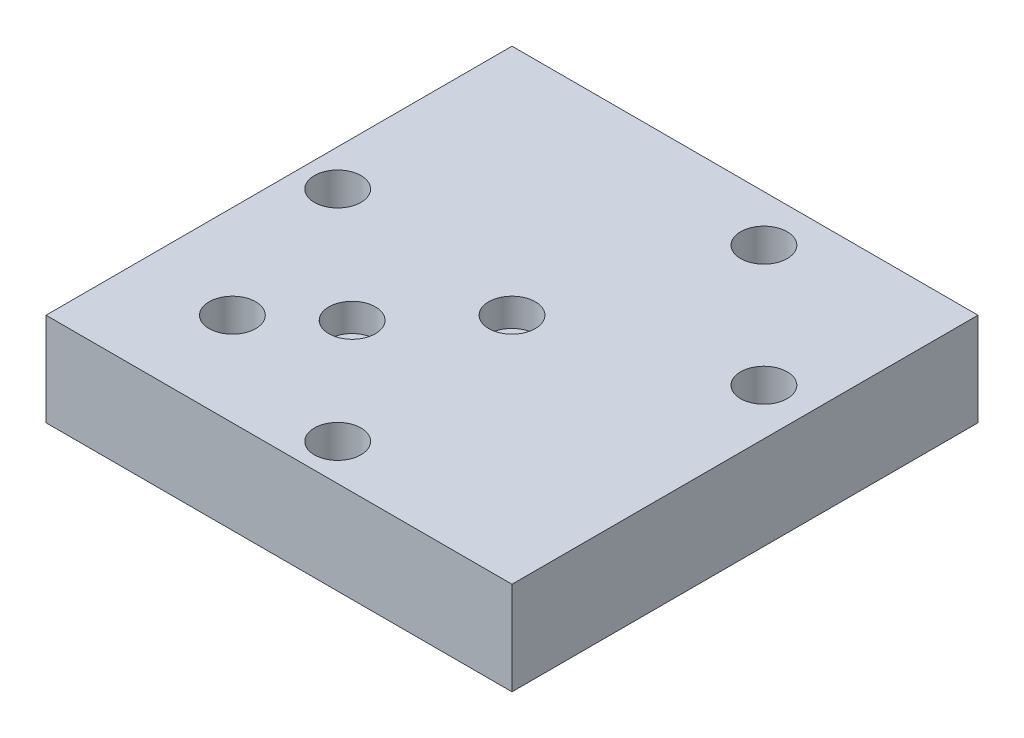
from build123d import *

# Parameters (mm, degrees)
SKETCH1_W                                           = 1270
SKETCH1_H                                           = 1270
SKETCH1_R                                           = 63.5
BOSS_EXTRUDE1_DEPTH                                 = 254
CBORE_FOR_00_BINDING_HEAD_MACHINE_SCREW_D           = 76.2
CBORE_FOR_00_BINDING_HEAD_MACHINE_SCREW_CBORE_D     = 127
CBORE_FOR_00_BINDING_HEAD_MACHINE_SCREW_CBORE_DEPTH = 76.2


with BuildPart() as part:
    # Sketch1 → Boss-Extrude1 (new body)
    with BuildSketch(Plane(origin=(0, 0, 0), x_dir=(1, 0, 0), z_dir=(0, 1, 0))):
        Rectangle(SKETCH1_W, SKETCH1_H)
        with Locations((-381, -381)):
            Circle(SKETCH1_R, mode=Mode.SUBTRACT)
        with Locations((-535.427409328, 60.328180312)):
            Circle(SKETCH1_R, mode=Mode.SUBTRACT)
        with Locations((177.959434067, 508.578843275)):
            Circle(SKETCH1_R, mode=Mode.SUBTRACT)
        with Locations((508.578843275, 177.959434067)):
            Circle(SKETCH1_R, mode=Mode.SUBTRACT)
        with Locations((60.328180312, -535.427409328)):
            Circle(SKETCH1_R, mode=Mode.SUBTRACT)
    extrude(amount=BOSS_EXTRUDE1_DEPTH)

    # CBORE for #00 Binding Head Machine Screw1 (through all)
    with Locations(Plane(origin=(0, 254, 0), x_dir=(1, 0, 0), z_dir=(0, 1, 0))):
        with Locations((0, 0), (-205.835932946, -229.858685708)):
            CounterBoreHole(CBORE_FOR_00_BINDING_HEAD_MACHINE_SCREW_D / 2, CBORE_FOR_00_BINDING_HEAD_MACHINE_SCREW_CBORE_D / 2, CBORE_FOR_00_BINDING_HEAD_MACHINE_SCREW_CBORE_DEPTH)


solid = part.part
